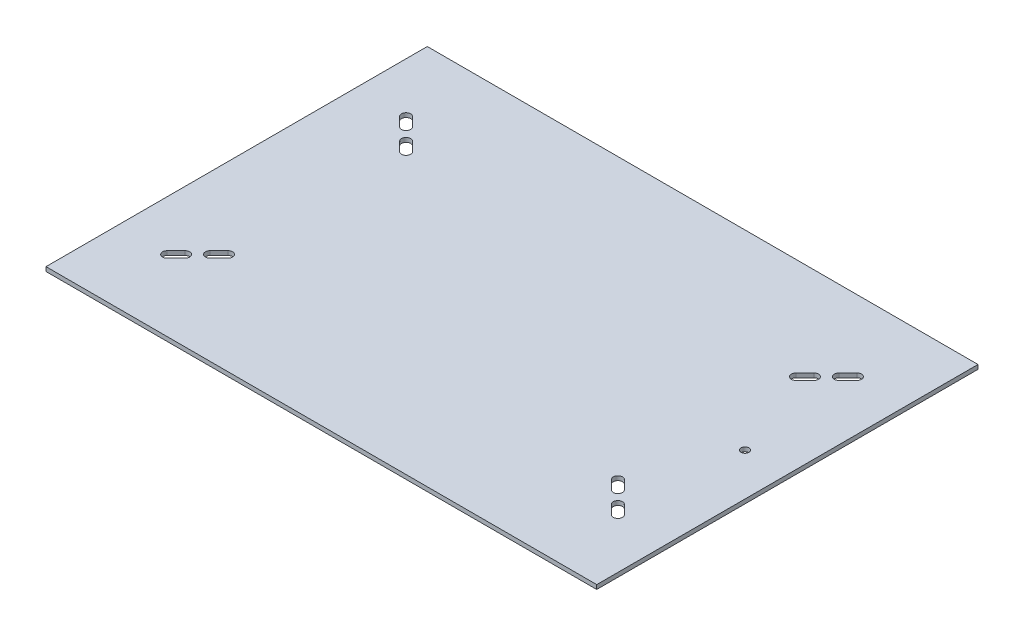
from build123d import *

# Parameters (mm, degrees)
SKETCH1_W            = 330.2
SKETCH1_H            = 228.6
BASE_PLATE_DEPTH     = 2.54
SLOTS_DEPTH          = 402.617294946
ESD_CONNECTOR_HOLE_D = 4.7625


with BuildPart() as part:
    # Sketch1 → base plate (new body)
    with BuildSketch(Plane(origin=(0, 0, 0), x_dir=(1, 0, 0), z_dir=(0, 1, 0))):
        with Locations((165.1, -114.3)):
            Rectangle(SKETCH1_W, SKETCH1_H)
    extrude(amount=-BASE_PLATE_DEPTH)

    # Sketch3 → slots (cut, through all)
    with BuildSketch(Plane(origin=(0, 0, 0), x_dir=(1, 0, 0), z_dir=(0, 1, 0))):
        with BuildLine():
            Line((33.404828058, -178.606084521), (28.016674385, -183.994238194))
            ThreePointArc((28.016674385, -183.994238194), (28.016674385, -187.883325615), (31.905761806, -187.883325615))
            Line((31.905761806, -187.883325615), (37.293915479, -182.495171942))
            ThreePointArc((37.293915479, -182.495171942), (37.293915479, -178.606084521), (33.404828058, -178.606084521))
        make_face()
        with BuildLine():
            Line((44.775105348, -175.013982073), (50.163259021, -169.6258284))
            ThreePointArc((50.163259021, -169.6258284), (50.163259021, -165.736740979), (46.2741716, -165.736740979))
            Line((46.2741716, -165.736740979), (40.886017927, -171.124894652))
            ThreePointArc((40.886017927, -171.124894652), (40.886017927, -175.013982073), (44.775105348, -175.013982073))
        make_face()
        with BuildLine():
            ThreePointArc((31.905761806, -40.716674385), (28.016674385, -40.716674385), (28.016674385, -44.605761806))
            Line((28.016674385, -44.605761806), (33.404828058, -49.993915479))
            ThreePointArc((33.404828058, -49.993915479), (37.293915479, -49.993915479), (37.293915479, -46.104828058))
            Line((37.293915479, -46.104828058), (31.905761806, -40.716674385))
        make_face()
        with BuildLine():
            ThreePointArc((46.2741716, -62.863259021), (50.163259021, -62.863259021), (50.163259021, -58.9741716))
            Line((50.163259021, -58.9741716), (44.775105348, -53.586017927))
            ThreePointArc((44.775105348, -53.586017927), (40.886017927, -53.586017927), (40.886017927, -57.475105348))
            Line((40.886017927, -57.475105348), (46.2741716, -62.863259021))
        make_face()
        with BuildLine():
            Line((296.795171942, -49.993915479), (302.183325615, -44.605761806))
            ThreePointArc((302.183325615, -44.605761806), (302.183325615, -40.716674385), (298.294238194, -40.716674385))
            Line((298.294238194, -40.716674385), (292.906084521, -46.104828058))
            ThreePointArc((292.906084521, -46.104828058), (292.906084521, -49.993915479), (296.795171942, -49.993915479))
        make_face()
        with BuildLine():
            Line((285.424894652, -53.586017927), (280.036740979, -58.9741716))
            ThreePointArc((280.036740979, -58.9741716), (280.036740979, -62.863259021), (283.9258284, -62.863259021))
            Line((283.9258284, -62.863259021), (289.313982073, -57.475105348))
            ThreePointArc((289.313982073, -57.475105348), (289.313982073, -53.586017927), (285.424894652, -53.586017927))
        make_face()
        with BuildLine():
            ThreePointArc((283.9258284, -165.736740979), (280.036740979, -165.736740979), (280.036740979, -169.6258284))
            Line((280.036740979, -169.6258284), (285.424894652, -175.013982073))
            ThreePointArc((285.424894652, -175.013982073), (289.313982073, -175.013982073), (289.313982073, -171.124894652))
            Line((289.313982073, -171.124894652), (283.9258284, -165.736740979))
        make_face()
        with BuildLine():
            ThreePointArc((298.294238194, -187.883325615), (302.183325615, -187.883325615), (302.183325615, -183.994238194))
            Line((302.183325615, -183.994238194), (296.795171942, -178.606084521))
            ThreePointArc((296.795171942, -178.606084521), (292.906084521, -178.606084521), (292.906084521, -182.495171942))
            Line((292.906084521, -182.495171942), (298.294238194, -187.883325615))
        make_face()
    extrude(amount=-SLOTS_DEPTH, mode=Mode.SUBTRACT)

    # ESD connector hole (through all)
    with Locations(Plane(origin=(0, 0, 0), x_dir=(1, 0, 0), z_dir=(0, 1, 0))):
        with Locations((304.8, -114.3)):
            Hole(ESD_CONNECTOR_HOLE_D / 2)


solid = part.part
